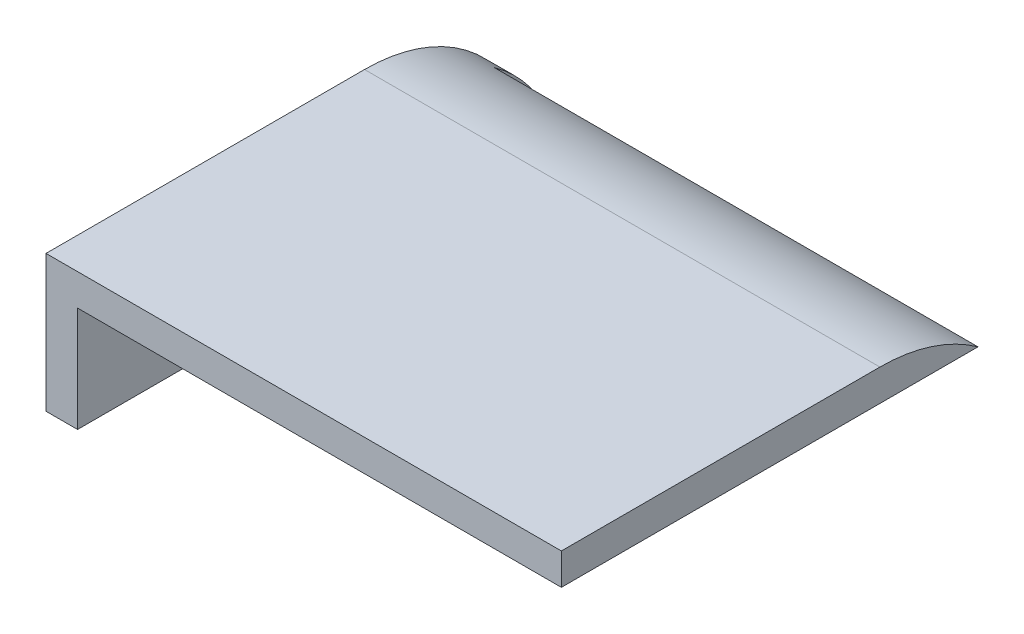
from build123d import *

# Parameters (mm, degrees)
Y_KSEKLIK_EKSTR_ZYON1_DEPTH = 46
RADYUS1_DEPTH               = 49


with BuildPart() as part:
    # Çizim1 → Yükseklik-Ekstrüzyon1 (new body)
    with BuildSketch(Plane.XY):
        Polygon((0, 0), (0, 13), (49, 13), (49, 10), (3, 10), (3, 0), align=None)
    extrude(amount=Y_KSEKLIK_EKSTR_ZYON1_DEPTH)

    # Radyus1: read off the stored shape, not the designer's step
    # Radyus1 outline → Radyus1 (cut)
    with BuildSketch(Plane.YZ):
        with BuildLine():
            Line((0, 0), (13, 0))
            Line((13, 0), (13, 15.716233646))
            ThreePointArc((13, 15.716233646), (9.328828006, 5.518194618), (0, 0))
        make_face()
    extrude(amount=RADYUS1_DEPTH, mode=Mode.SUBTRACT)


solid = part.part
